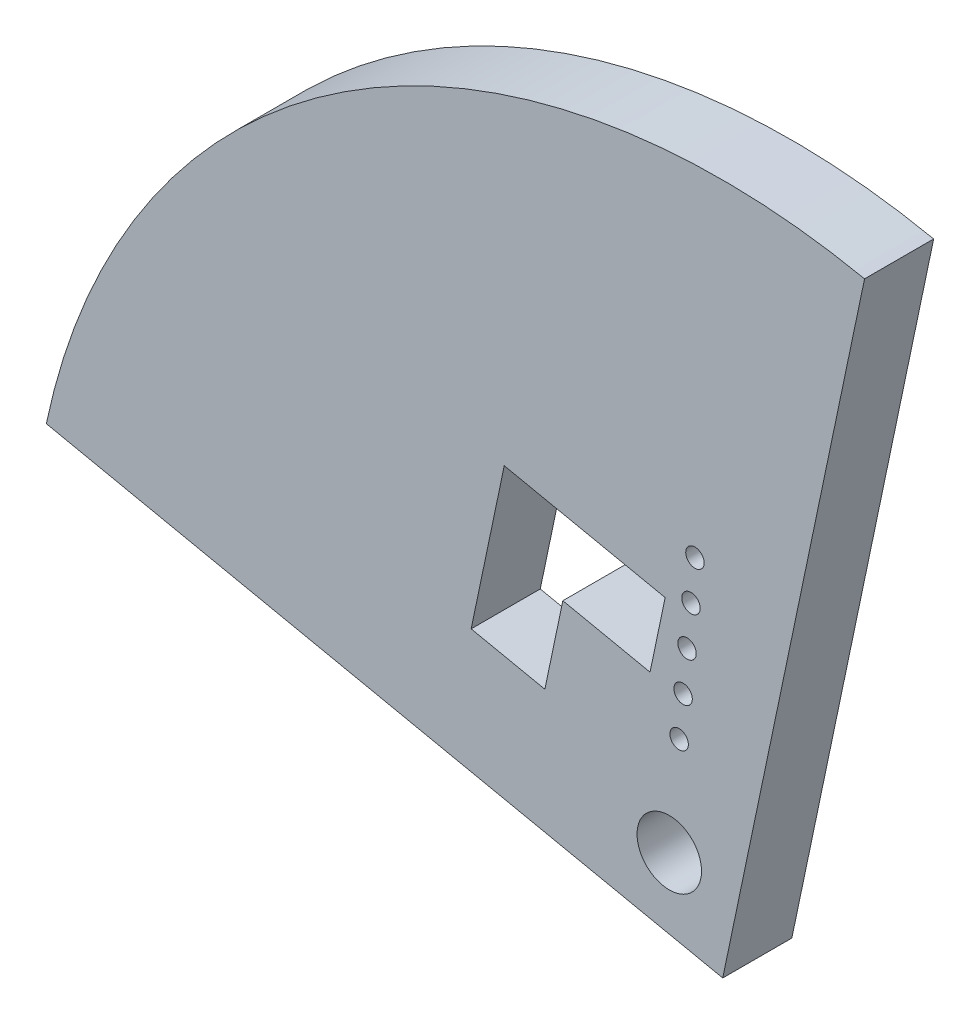
from build123d import *

# Parameters (mm, degrees)
BOSS_EXTRUDE2_DEPTH = 3.81
SKETCH3_R           = 1.778
CUT_EXTRUDE1_DEPTH  = 83.609172725
CUT_EXTRUDE2_DEPTH  = 83.609172725
SKETCH5_R           = 0.508
CUT_EXTRUDE3_DEPTH  = 83.609172725


with BuildPart() as part:
    # Sketch2 → Boss-Extrude2 (new body)
    with BuildSketch(Plane.XY):
        with BuildLine():
            Line((-11.22087151, 59.495333804), (-19.039557078, 22.20621802))
            Line((-19.039557078, 22.20621802), (-56.328672862, 30.024903588))
            ThreePointArc((-56.328672862, 30.024903588), (-39.878298128, 54.102250241), (-11.22087151, 59.495333804))
        make_face()
    extrude(amount=BOSS_EXTRUDE2_DEPTH)

    # Sketch3 → Cut-Extrude1 (cut, through all)
    with BuildSketch(Plane.XY.offset(3.81)):
        with Locations((-21.986600099, 26.716998155)):
            Circle(SKETCH3_R)
    extrude(amount=-CUT_EXTRUDE1_DEPTH, mode=Mode.SUBTRACT)

    # Sketch4 → Cut-Extrude2 (cut, through all)
    with BuildSketch(Plane(origin=(0, 0, 0), x_dir=(-1, 0, 0), z_dir=(0, 0, -1))):
        Polygon((31.084073207, 40.641701891), (22.213000878, 38.781638338), (23.046994005, 34.804132654), (27.854066334, 35.812067175), (28.844433172, 31.088779176), (32.908433172, 31.940908208), align=None)
    extrude(amount=-CUT_EXTRUDE2_DEPTH, mode=Mode.SUBTRACT)

    # Sketch5 → Cut-Extrude3 (cut, through all)
    with BuildSketch(Plane(origin=(0, 0, 0), x_dir=(-1, 0, 0), z_dir=(0, 0, -1))):
        with Locations((21.442544534, 32.406042762)):
            Circle(SKETCH5_R)
        with Locations((21.224922308, 34.681660605)):
            Circle(SKETCH5_R)
        with Locations((21.007300082, 36.957278448)):
            Circle(SKETCH5_R)
        with Locations((20.57205563, 41.508514134)):
            Circle(SKETCH5_R)
        with Locations((20.789677856, 39.232896291)):
            Circle(SKETCH5_R)
    extrude(amount=-CUT_EXTRUDE3_DEPTH, mode=Mode.SUBTRACT)


solid = part.part
